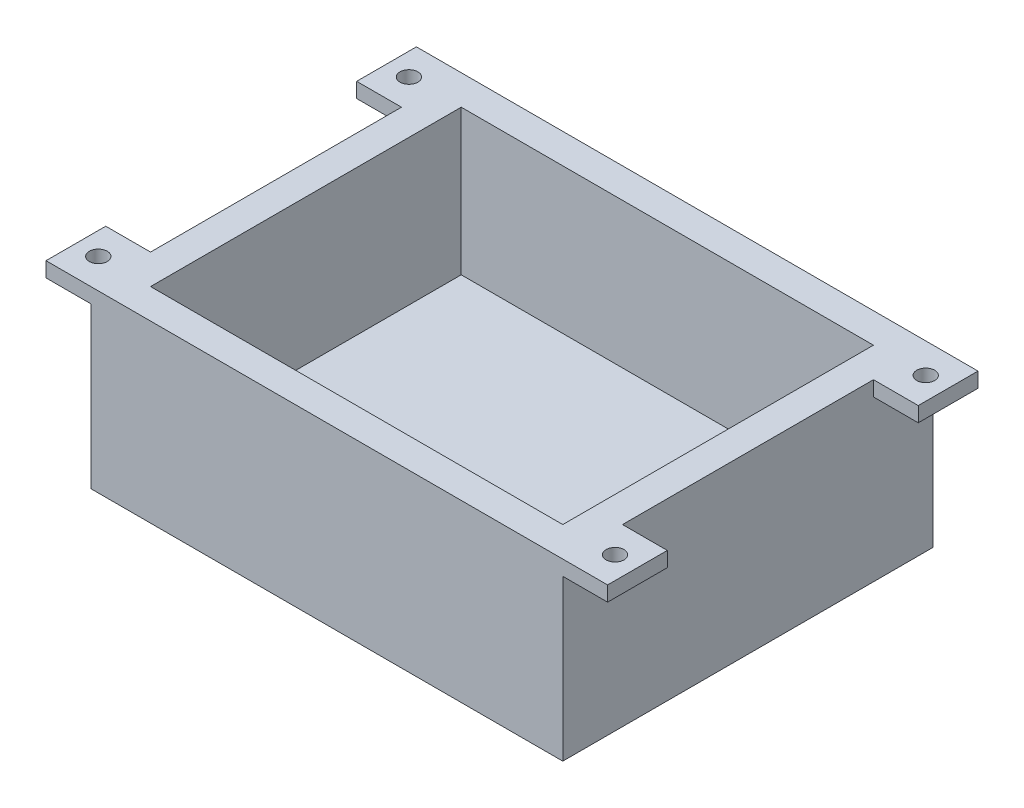
from build123d import *

# Parameters (mm, degrees)
SKETCH1_W               = 79
SKETCH1_H               = 62
SKETCH1_W_2             = 69
SKETCH1_H_2             = 52
BOSS_EXTRUDE1_DEPTH     = 24.3
SKETCH1_2_W             = 79
SKETCH1_2_H             = 62
BOSS_EXTRUDE2_DEPTH     = 5
SKETCH3_W               = 10
SKETCH3_H               = 2.5
BOSS_EXTRUDE3_DEPTH     = 7.5
CUT_EXTRUDE1_DEPTH      = 63.355753544
CUT_EXTRUDE1_DEPTH_BACK = 63.355753544
SKETCH4_R               = 1.5


with BuildPart() as part:
    # Sketch1 → Boss-Extrude1 (new body)
    with BuildSketch(Plane(origin=(0, 0, 0), x_dir=(1, 0, 0), z_dir=(0, 1, 0))):
        Rectangle(SKETCH1_W, SKETCH1_H)
        Rectangle(SKETCH1_W_2, SKETCH1_H_2, mode=Mode.SUBTRACT)
    extrude(amount=BOSS_EXTRUDE1_DEPTH)

    # Sketch1<2> → Boss-Extrude2 (add)
    with BuildSketch(Plane(origin=(0, 0, 0), x_dir=(1, 0, 0), z_dir=(0, 1, 0))):
        Rectangle(SKETCH1_2_W, SKETCH1_2_H)
    extrude(amount=-BOSS_EXTRUDE2_DEPTH)

    # Sketch3 → Boss-Extrude3 (add)
    with BuildSketch(Plane.ZY.offset(39.5)):
        with Locations((-26, 23.05)):
            Rectangle(SKETCH3_W, SKETCH3_H)
        with Locations((26, 23.05)):
            Rectangle(SKETCH3_W, SKETCH3_H)
    boss_extrude3 = extrude(amount=BOSS_EXTRUDE3_DEPTH)

    # Mirror1: Boss-Extrude3 across plane
    add(boss_extrude3.mirror(Plane.ZY))

    # Sketch4 → Cut-Extrude1 (cut, two sides: drawn at the far end of the back side and taken through both)
    with BuildSketch(Plane.XZ.offset(-21.8).offset(-CUT_EXTRUDE1_DEPTH_BACK)):
        with Locations((43.25, 26)):
            Circle(SKETCH4_R)
        with Locations((-43.25, 26)):
            Circle(SKETCH4_R)
        with Locations((-43.25, -26)):
            Circle(SKETCH4_R)
        with Locations((43.25, -26)):
            Circle(SKETCH4_R)
    extrude(amount=CUT_EXTRUDE1_DEPTH + CUT_EXTRUDE1_DEPTH_BACK, mode=Mode.SUBTRACT)


solid = part.part
